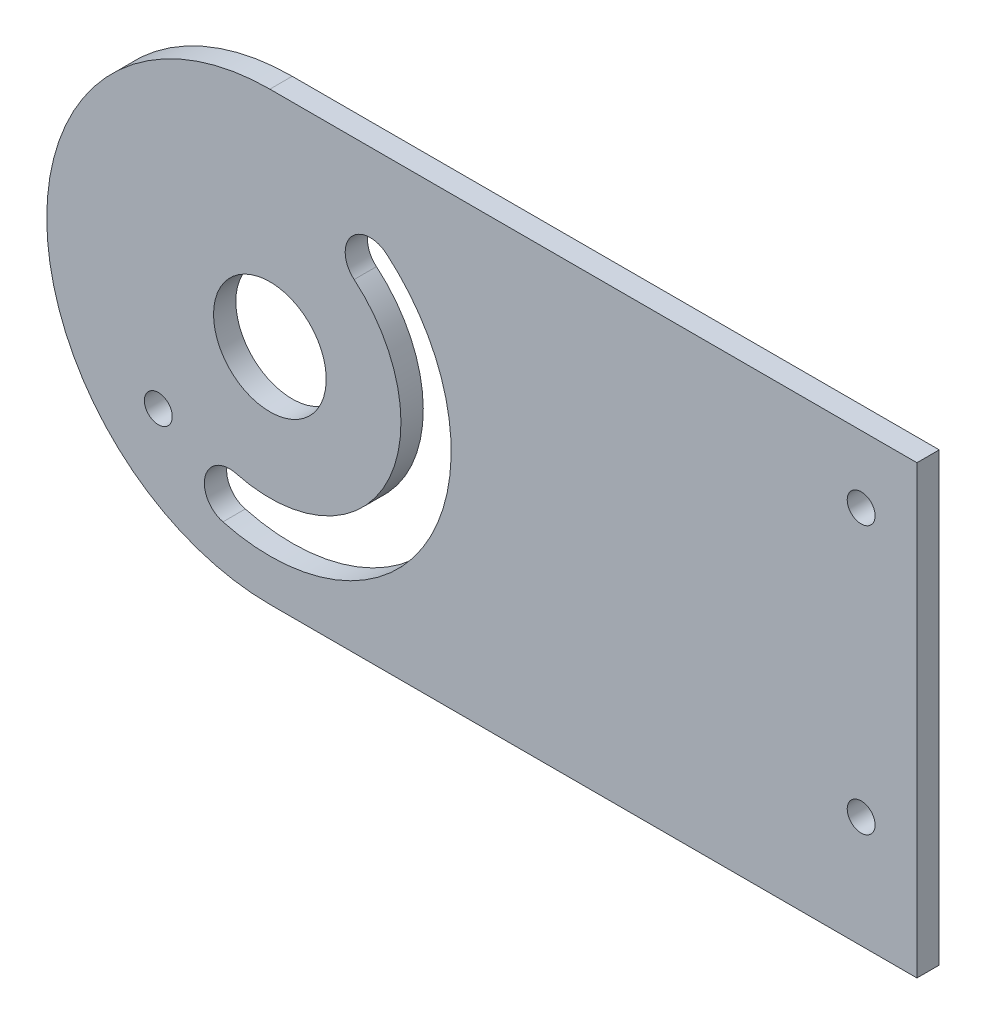
from build123d import *

# Parameters (mm, degrees)
SKETCH_2_W                   = 78
SKETCH_2_H                   = 40
EXTRUDE_1_DEPTH              = 2
SKETCH_3_R                   = 5.05
SKETCH_3_R_2                 = 1.25
CUT_EXTRUDE_1_DEPTH          = 88.681240867
SKETCH_4_R                   = 1.25
CUT_EXTRUDE_2_DEPTH          = 88.681240867
FILLET_1_R                   = 20
HOLE_WIZARD_M3_1_D           = 2.5
HOLE_WIZARD_M3_1_CSINK_D     = 2.55
HOLE_WIZARD_M3_1_CSINK_ANGLE = 90


with BuildPart() as part:
    # 草图2 → 凸台-拉伸1 (new body)
    with BuildSketch(Plane.XY):
        with Locations((39, 20)):
            Rectangle(SKETCH_2_W, SKETCH_2_H)
    extrude(amount=EXTRUDE_1_DEPTH)

    # 草图3 → 切除-拉伸1 (cut, through all)
    with BuildSketch(Plane(origin=(0, 0, 0), x_dir=(-1, 0, 0), z_dir=(0, 0, -1))):
        with Locations((-20, 20)):
            Circle(SKETCH_3_R)
        with Locations((-10, 10.202041029)):
            Circle(SKETCH_3_R_2)
        with BuildLine():
            ThreePointArc((-30.446428571, 32.447274003), (-34.413244876, 12.495276677), (-15.792765742, 4.30408716))
            ThreePointArc((-15.792765742, 4.30408716), (-14.20202563, 7.059907527), (-16.957845998, 8.650647638))
            ThreePointArc((-16.957845998, 8.650647638), (-30.421884756, 14.573507751), (-27.553571429, 29.000336587))
            ThreePointArc((-27.553571429, 29.000336587), (-27.276531292, 32.170233866), (-30.446428571, 32.447274003))
        make_face()
    extrude(amount=-CUT_EXTRUDE_1_DEPTH, mode=Mode.SUBTRACT)

    # 草图4 → 切除-拉伸2 (cut, through all)
    with BuildSketch(Plane(origin=(0, 0, 0), x_dir=(-1, 0, 0), z_dir=(0, 0, -1))):
        with Locations((-73, 34)):
            Circle(SKETCH_4_R)
        with Locations((-73, 10)):
            Circle(SKETCH_4_R)
    extrude(amount=-CUT_EXTRUDE_2_DEPTH, mode=Mode.SUBTRACT)

    # 圆角1
    fillet_1_edges = [part.edges().sort_by_distance(p)[0] for p in [
        (0, 40, 1),
        (0, 0, 1),
    ]]
    fillet(fillet_1_edges, radius=FILLET_1_R - 0.0001)  # a hair under: the kernel refuses the full size

    # M3 螺纹孔的螺纹孔钻头1 (through all)
    with Locations(Plane(origin=(73, 34, 0), x_dir=(-1, 0, 0), z_dir=(0, 0, -1))):
        with Locations((0, 0), (0, -24)):
            CounterSinkHole(HOLE_WIZARD_M3_1_D / 2, HOLE_WIZARD_M3_1_CSINK_D / 2, counter_sink_angle=HOLE_WIZARD_M3_1_CSINK_ANGLE)


solid = part.part
